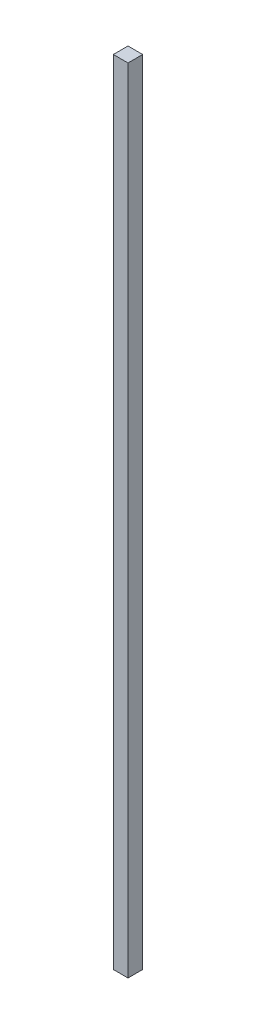
from build123d import *

# Parameters (mm, degrees)
SKIZZE1_W                       = 50
SKIZZE1_H                       = 50
AUFSATZ_LINEAR_AUSTRAGEN1_DEPTH = 2700


with BuildPart() as part:
    # Skizze1 → Aufsatz-Linear austragen1 (new body)
    with BuildSketch(Plane(origin=(0, 0, 0), x_dir=(1, 0, 0), z_dir=(0, 1, 0))):
        with Locations((25, 25)):
            Rectangle(SKIZZE1_W, SKIZZE1_H)
    extrude(amount=AUFSATZ_LINEAR_AUSTRAGEN1_DEPTH)


solid = part.part
